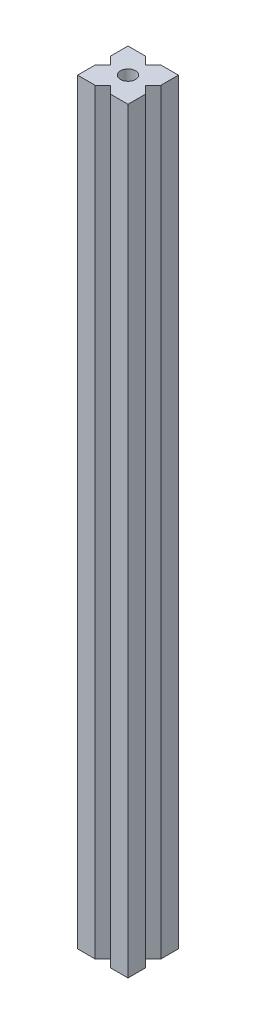
from build123d import *

# Parameters (mm, degrees)
SKIZZE1_W                       = 20
SKIZZE1_H                       = 20
AUFSATZ_LINEAR_AUSTRAGEN1_DEPTH = 300
SCHNITT_LINEAR_AUSTRAGEN1_DEPTH = 302.330383466
SKIZZE3_R                       = 3
SCHNITT_LINEAR_AUSTRAGEN2_DEPTH = 302.330383466


with BuildPart() as part:
    # Skizze1 → Aufsatz-Linear austragen1 (new body)
    with BuildSketch(Plane(origin=(0, 0, 0), x_dir=(1, 0, 0), z_dir=(0, 1, 0))):
        with Locations((10, 10)):
            Rectangle(SKIZZE1_W, SKIZZE1_H)
    extrude(amount=AUFSATZ_LINEAR_AUSTRAGEN1_DEPTH)

    # Skizze2 → Schnitt-Linear austragen1 (cut, through all)
    with BuildSketch(Plane(origin=(0, 300, 0), x_dir=(1, 0, 0), z_dir=(0, 1, 0))):
        Polygon((7, 20), (10, 17), (13, 20), align=None)
        Polygon((20, 13), (17, 10), (20, 7), align=None)
        Polygon((0, 7), (0, 13), (3, 10), align=None)
        Polygon((7, 0), (13, 0), (10, 3), align=None)
    extrude(amount=-SCHNITT_LINEAR_AUSTRAGEN1_DEPTH, mode=Mode.SUBTRACT)

    # Skizze3 → Schnitt-Linear austragen2 (cut, through all)
    with BuildSketch(Plane(origin=(0, 300, 0), x_dir=(1, 0, 0), z_dir=(0, 1, 0))):
        with Locations((10, 10)):
            Circle(SKIZZE3_R)
    extrude(amount=-SCHNITT_LINEAR_AUSTRAGEN2_DEPTH, mode=Mode.SUBTRACT)


solid = part.part
